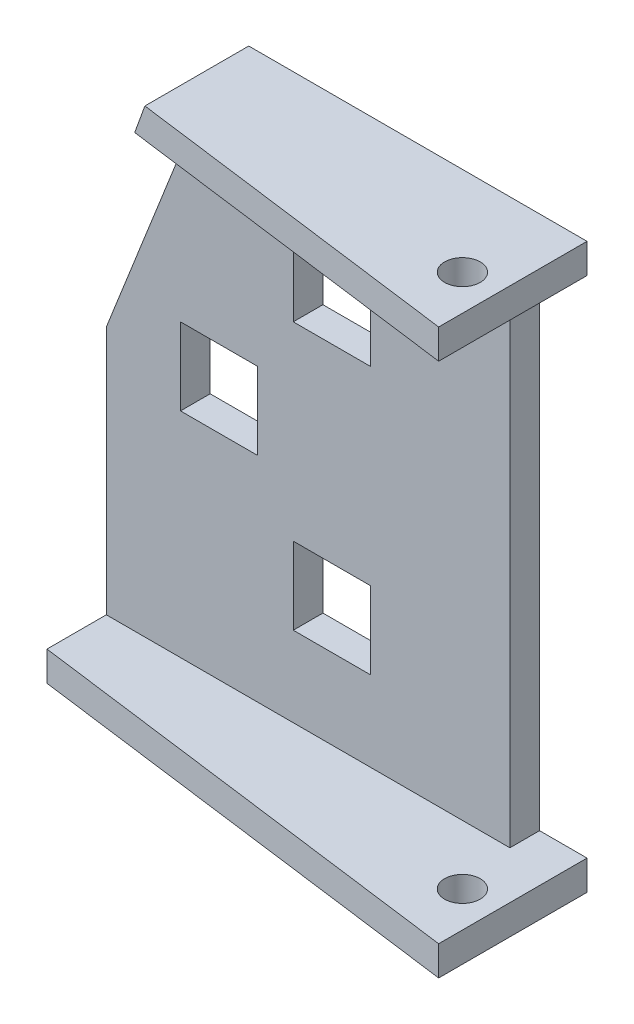
from build123d import *

# Parameters (mm, degrees)
BOSS_EXTRUDE1_DEPTH = 5
SKETCH2_W           = 13
SKETCH2_H           = 13
CUT_EXTRUDE1_DEPTH  = 119.11011811
SKETCH5_W           = 76
SKETCH5_H           = 5
BOSS_EXTRUDE3_DEPTH = 20
CUT_EXTRUDE2_DEPTH  = 121.623380818
SKETCH7_R           = 3
CUT_EXTRUDE4_DEPTH  = 121.623380818
SKETCH8_W           = 8
SKETCH8_H           = 85
CUT_EXTRUDE5_DEPTH  = 120.687092036


with BuildPart() as part:
    # Sketch1 → Boss-Extrude1 (new body)
    with BuildSketch(Plane.XY):
        Polygon((-70, 0), (6, 0), (6, 95), (-51, 95), (-70, 47), align=None)
    extrude(amount=BOSS_EXTRUDE1_DEPTH)

    # Sketch2 → Cut-Extrude1 (cut, through all)
    with BuildSketch(Plane.XY.offset(5)):
        with Locations((-32, 70)):
            Rectangle(SKETCH2_W, SKETCH2_H)
        with Locations((-32, 25)):
            Rectangle(SKETCH2_W, SKETCH2_H)
        with Locations((-51, 47.5)):
            Rectangle(SKETCH2_W, SKETCH2_H)
    extrude(amount=-CUT_EXTRUDE1_DEPTH, mode=Mode.SUBTRACT)

    # Sketch5 → Boss-Extrude3 (add)
    with BuildSketch(Plane.XY.offset(5)):
        Polygon((-51, 95), (-52.979166667, 90), (6, 90), (6, 95), align=None)
        with Locations((-32, 2.5)):
            Rectangle(SKETCH5_W, SKETCH5_H)
    extrude(amount=BOSS_EXTRUDE3_DEPTH)

    # Sketch6 → Cut-Extrude2 (cut, through all)
    with BuildSketch(Plane.XZ):
        Polygon((6, 25), (-70, 15), (-70, 25), align=None)
    extrude(amount=-CUT_EXTRUDE2_DEPTH, mode=Mode.SUBTRACT)

    # Sketch7 → Cut-Extrude4 (cut, through all)
    with BuildSketch(Plane(origin=(0, 95, 0), x_dir=(1, 0, 0), z_dir=(0, 1, 0))):
        with Locations((0, -15)):
            Circle(SKETCH7_R)
    extrude(amount=-CUT_EXTRUDE4_DEPTH, mode=Mode.SUBTRACT)

    # Sketch8 → Cut-Extrude5 (cut, through all)
    with BuildSketch(Plane.XY.offset(5)):
        with Locations((2, 47.5)):
            Rectangle(SKETCH8_W, SKETCH8_H)
    extrude(amount=-CUT_EXTRUDE5_DEPTH, mode=Mode.SUBTRACT)


solid = part.part
